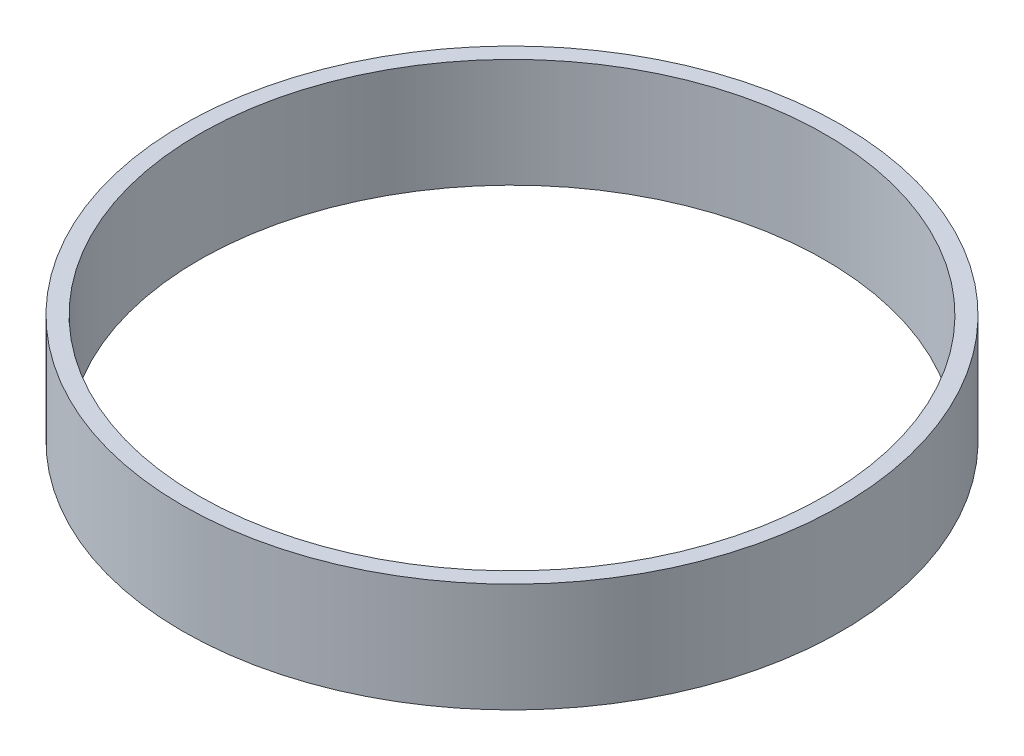
from build123d import *

# Parameters (mm, degrees)
BASE_R                                               = 121
BASE_R_2                                             = 115
BASE_EXTRUDE_DEPTH                                   = 40
CSK_FOR_M5_COUNTERSUNK_RAISED_HEAD_SCREW_D           = 5.5
CSK_FOR_M5_COUNTERSUNK_RAISED_HEAD_SCREW_DEPTH       = 20
CSK_FOR_M5_COUNTERSUNK_RAISED_HEAD_SCREW_CSINK_D     = 10.4
CSK_FOR_M5_COUNTERSUNK_RAISED_HEAD_SCREW_CSINK_ANGLE = 90
CSK_FOR_M5_COUNTERSUNK_RAISED_HEAD_SCREW_TIP         = 1.652366702


with BuildPart() as part:
    # Base → Base-Extrude (new body)
    with BuildSketch(Plane(origin=(0, 0, 0), x_dir=(1, 0, 0), z_dir=(0, 1, 0))):
        Circle(BASE_R)
        Circle(BASE_R_2, mode=Mode.SUBTRACT)
    extrude(amount=BASE_EXTRUDE_DEPTH)

    # CSK for M5 Countersunk Raised Head Screw1
    with Locations(Plane(origin=(37.968714772, -4, -14.434938782), x_dir=(-1, 0, 0), z_dir=(0, -1, 0))):
        with Locations((-45.469885408, -97.873538962), (-80.031285228, -14.434938782), (-45.469885408, 69.003661398), (37.968714772, 103.565061218), (121.407314952, 69.003661398), (155.968714772, -14.434938782), (121.407314952, -97.873538962), (37.968714772, -132.434938782)):
            CounterSinkHole(CSK_FOR_M5_COUNTERSUNK_RAISED_HEAD_SCREW_D / 2, CSK_FOR_M5_COUNTERSUNK_RAISED_HEAD_SCREW_CSINK_D / 2, depth=CSK_FOR_M5_COUNTERSUNK_RAISED_HEAD_SCREW_DEPTH, counter_sink_angle=CSK_FOR_M5_COUNTERSUNK_RAISED_HEAD_SCREW_CSINK_ANGLE)
            with Locations((0, 0, -(CSK_FOR_M5_COUNTERSUNK_RAISED_HEAD_SCREW_DEPTH + CSK_FOR_M5_COUNTERSUNK_RAISED_HEAD_SCREW_TIP / 2))):  # 118° drill point
                Cone(0, CSK_FOR_M5_COUNTERSUNK_RAISED_HEAD_SCREW_D / 2, CSK_FOR_M5_COUNTERSUNK_RAISED_HEAD_SCREW_TIP, mode=Mode.SUBTRACT)


solid = part.part
